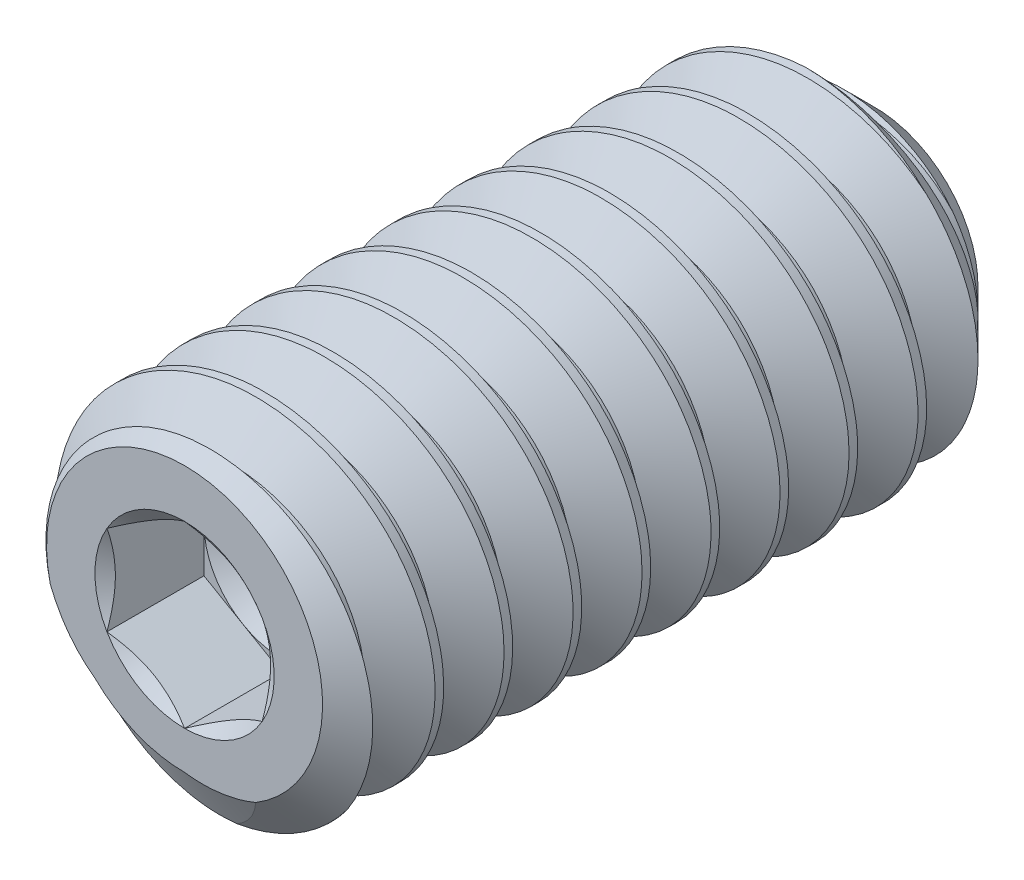
from build123d import *

# Parameters (mm, degrees)
CUT_EXTRUDE10_DEPTH = 0.5625
CUT_SWEEP2_PITCH    = 0.4


with BuildPart() as part:
    # Sketch22 → Revolve1 (revolve)
    with BuildSketch(Plane(origin=(0, 0, 0), x_dir=(0, 0, -1), z_dir=(1, 0, 0)), mode=Mode.PRIVATE) as revolve1_sk:
        Polygon((-2, 0), (-2, 0.8), (-1.859958492, 1), (1.6, 1), (2, 0.6), (2, 0), align=None)
    revolve(revolve1_sk.sketch.rotate(Axis((0, 0, -2), (0, 0, 1)), 90), axis=Axis((0, 0, -2), (0, 0, 1)))

    # Sketch23 → Cut-Extrude10 (cut)
    with BuildSketch(Plane.XY.offset(2)):
        Polygon((0, 0.519615242), (-0.45, 0.259807621), (-0.45, -0.259807621), (0, -0.519615242), (0.45, -0.259807621), (0.45, 0.259807621), align=None)
    extrude(amount=-CUT_EXTRUDE10_DEPTH, mode=Mode.SUBTRACT)

    # Cut-Extrude11 cone 1 section (through the dimple's axis) → Cut-Extrude11 (revolve, cut)
    with BuildSketch(Plane(origin=(0, 0, 2), x_dir=(0, -1, 0), z_dir=(1, 0, 0))):
        Polygon((0, 0), (0.519615242, 0), (0, 0.36383851), align=None)
    revolve(axis=Axis((0, 0, 2), (0, 0, -1)), mode=Mode.SUBTRACT)

    # Cut-Extrude12 cone 1 section (through the dimple's axis) → Cut-Extrude12 (revolve, cut)
    with BuildSketch(Plane(origin=(0, 0, 1.4375), x_dir=(0, -1, 0), z_dir=(1, 0, 0))):
        Polygon((0, 0), (0.45, 0), (0, 0.259807621), align=None)
    revolve(axis=Axis((0, 0, 1.4375), (0, 0, -1)), mode=Mode.SUBTRACT)

    # Cut-Sweep2: the profile of Sketch28 profile screwed along a right-hand helix of 11 turns, 6 arcs to a turn; built about Z, then put on its axis
    cut_sweep2_z = Axis((0, 0, 0), (0, 0, 1))
    cut_sweep2_corners = [(1.0003, 0, 0.000173205), (1.0003, 0, -0.350173205), (0.740192379, 0, -0.2), (0.740192379, 0, -0.15)]
    with BuildLine(mode=Mode.PRIVATE) as cut_sweep2_profile:
        Line(cut_sweep2_corners[0], cut_sweep2_corners[1])
        Line(cut_sweep2_corners[1], cut_sweep2_corners[2])
        Line(cut_sweep2_corners[2], cut_sweep2_corners[3])
        Line(cut_sweep2_corners[3], cut_sweep2_corners[0])
    cut_sweep2_cap = Face(cut_sweep2_profile.wire())
    cut_sweep2_turn_angles = [0, 30, 60, 90, 120, 150, 180, 210, 240, 270, 300, 330, 360]
    cut_sweep2_turn_weights = [1, 0.8660254037844387, 1, 0.8660254037844387, 1, 0.8660254037844387, 1, 0.8660254037844387, 1, 0.8660254037844387, 1, 0.8660254037844387, 1]
    cut_sweep2_turn_rails = [Edge.make_bspline([Vector(p[0], p[1], 0).rotate(cut_sweep2_z, cut_sweep2_turn_angles[k]) / cut_sweep2_turn_weights[k] + Vector(0, 0, p[2] + CUT_SWEEP2_PITCH * cut_sweep2_turn_angles[k] / 360) for k in range(13)], [0, 0, 0, 1, 1, 2, 2, 3, 3, 4, 4, 5, 5, 6, 6, 6], 2, cut_sweep2_turn_weights) for p in cut_sweep2_corners]
    cut_sweep2_turn_sides = [Face.make_surface_from_curves(cut_sweep2_turn_rails[p[0]], cut_sweep2_turn_rails[p[1]]) for p in [(0, 1), (1, 2), (2, 3), (3, 0)]]
    cut_sweep2 = Plane(origin=(0, 0, -2), x_dir=(0, 1, 0), z_dir=(0, 0, 1)) * Solid(Shell([*[p.moved(Location((0, 0, CUT_SWEEP2_PITCH * i))) for i in range(11) for p in cut_sweep2_turn_sides], cut_sweep2_cap, cut_sweep2_cap.rotate(cut_sweep2_z, 3960).moved(Location((0, 0, CUT_SWEEP2_PITCH * 3960 / 360)))]))
    add(cut_sweep2, mode=Mode.SUBTRACT)


solid = part.part
